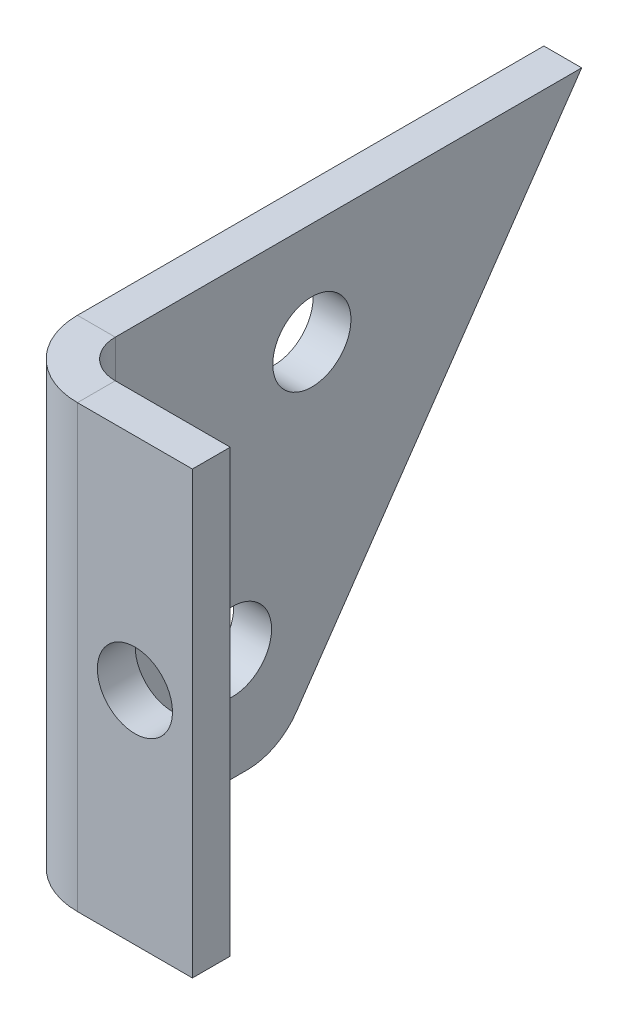
from build123d import *

# Parameters (mm, degrees)
SKETCH2_R                    = 3.282457618
BASE_FLANGE1_DEPTH           = 3.175
EDGE_FLANGE1_STRIP_W         = 19.05
EDGE_FLANGE1_STRIP_H         = 3.175
EDGE_FLANGE1_STRIP_CUT_DEPTH = 37
EDGE_FLANGE1_DEPTH           = 37
SKETCH6_R                    = 3.15
CUT_EXTRUDE1_DEPTH           = 10


# Sheet-metal steps are written as plain solids
with BuildPart() as part:
    # Sketch2 → Base-Flange1 (new body)
    with BuildSketch(Plane(origin=(0, 0, 0), x_dir=(0, 0, -1), z_dir=(1, 0, 0))):
        with BuildLine():
            Line((50.159054546, 37), (50.159054546, 0))
            Line((50.159054546, 0), (67.597909272, 0))
            ThreePointArc((67.597909272, 0), (69.925870777, 0.575003364), (71.718398003, 2.167761907))
            Line((71.718398003, 2.167761907), (95.660507303, 37))
            Line((95.660507303, 37), (50.159054546, 37))
        make_face()
        with Locations((73.009854993, 28.405566411)):
            Circle(SKETCH2_R, mode=Mode.SUBTRACT)
        with Locations((66.344990455, 9.222294526)):
            Circle(SKETCH2_R, mode=Mode.SUBTRACT)
    extrude(amount=-BASE_FLANGE1_DEPTH)

    # Edge-Flange1 strip (across the edge) → Edge-Flange1 strip cut (cut)
    with BuildSketch(Plane(origin=(0, 37, -50.159054546), x_dir=(0, 0, -1), z_dir=(0, -1, 0))):
        with Locations((-3.175, -1.5875)):
            Rectangle(EDGE_FLANGE1_STRIP_W, EDGE_FLANGE1_STRIP_H)
    extrude(amount=EDGE_FLANGE1_STRIP_CUT_DEPTH, mode=Mode.SUBTRACT)

    # Edge-Flange1 section (across the edge) → Edge-Flange1 (add)
    with BuildSketch(Plane(origin=(0, 37, -50.159054546), x_dir=(0, 0, -1), z_dir=(0, -1, 0))):
        with BuildLine():
            Line((0, 3.175), (0, 12.825))
            Line((0, 12.825), (3.175, 12.825))
            Line((3.175, 12.825), (3.175, 3.175))
            ThreePointArc((3.175, 3.175), (4.10493597, 0.92993597), (6.35, 0))
            Line((6.35, 0), (6.35, -3.175))
            ThreePointArc((6.35, -3.175), (1.859871939, -1.315128061), (0, 3.175))
        make_face()
    extrude(amount=EDGE_FLANGE1_DEPTH)

    # Sketch6 → Cut-Extrude1 (cut)
    with BuildSketch(Plane(origin=(0, 0, -53.334054546), x_dir=(-1, 0, 0), z_dir=(0, 0, -1))):
        with Locations((-8, 18.5)):
            Circle(SKETCH6_R)
    extrude(amount=-CUT_EXTRUDE1_DEPTH, mode=Mode.SUBTRACT)


solid = part.part
